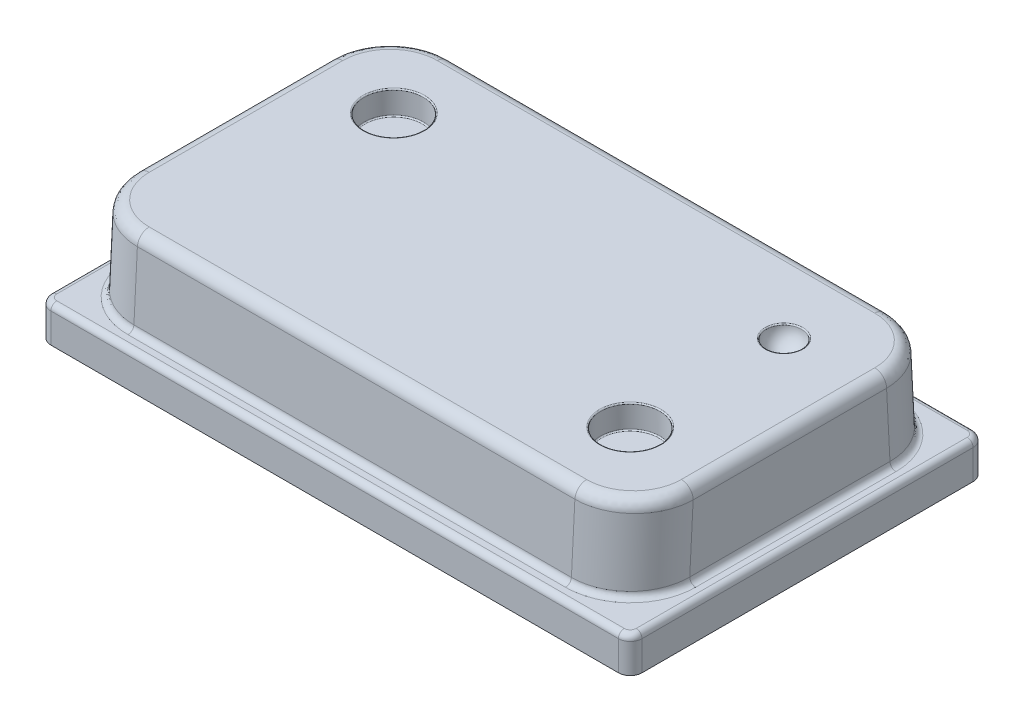
from build123d import *

# Parameters (mm, degrees)
IZIM1_W                     = 5
IZIM1_H                     = 3
Y_KSEKLIK_EKSTR_ZYON1_DEPTH = 0.3
Y_KSEKLIK_EKSTR_ZYON3_DEPTH = 2.35
IZIM5_R                     = 0.25
KES_EKSTR_ZYON1_DEPTH       = 0.2
IZIM11_R                    = 0.15
KES_EKSTR_ZYON3_DEPTH       = 0.15
RADYUS13_R                  = 0.15
RADYUS6_R                   = 0.1
RADYUS8_R                   = 0.5
RADYUS9_R                   = 0.1
RADYUS10_R                  = 0.05
RADYUS11_R                  = 0.05
RADYUS12_R                  = 0.01
RADYUS14_R                  = 0.01


with BuildPart() as part:
    # Çizim1 → Yükseklik-Ekstrüzyon1 (new body)
    with BuildSketch(Plane(origin=(0, 0, 0), x_dir=(1, 0, 0), z_dir=(0, 1, 0))):
        Rectangle(IZIM1_W, IZIM1_H)
    extrude(amount=Y_KSEKLIK_EKSTR_ZYON1_DEPTH)

    # Çizim3 → Yükseklik-Ekstrüzyon3 (add, symmetric)
    with BuildSketch(Plane(origin=(0, 0, 0), x_dir=(0, 0, -1), z_dir=(1, 0, 0))):
        Polygon((-1.35, 0.3), (1.35, 0.3), (1.313314555, 1), (-1.313314555, 1), align=None)
    extrude(amount=Y_KSEKLIK_EKSTR_ZYON3_DEPTH, both=True)

    # Çizim5 → Kes-Ekstrüzyon1 (cut)
    with BuildSketch(Plane(origin=(0, 1, 0), x_dir=(1, 0, 0), z_dir=(0, 1, 0))):
        with Locations(Location((1.65, -0.65, 0), (0, 0, 270))):
            Circle(IZIM5_R)
        with Locations(Location((-1.65, 0.65, 0), (0, 0, 270))):
            Circle(IZIM5_R)
    extrude(amount=-KES_EKSTR_ZYON1_DEPTH, mode=Mode.SUBTRACT)

    # Çizim11 → Kes-Ekstrüzyon3 (cut)
    with BuildSketch(Plane(origin=(0, 1, 0), x_dir=(1, 0, 0), z_dir=(0, 1, 0))):
        with Locations(Location((1.65, 0.65, 0), (0, 0, 270))):
            Circle(IZIM11_R)
    extrude(amount=-KES_EKSTR_ZYON3_DEPTH, mode=Mode.SUBTRACT)

    # Radyus13
    radyus13_edges = [part.edges().sort_by_distance(p)[0] for p in [
        (1.65, 0.85, -0.8),
    ]]
    fillet(radyus13_edges, radius=RADYUS13_R - 0.0001)  # a hair under: the kernel refuses the full size

    # Radyus6
    radyus6_edges = [part.edges().sort_by_distance(p)[0] for p in [
        (2.5, 0.15, 1.5),
        (-2.5, 0.15, 1.5),
        (-2.5, 0.15, -1.5),
        (2.5, 0.15, -1.5),
    ]]
    fillet(radyus6_edges, radius=RADYUS6_R)

    # Radyus8
    radyus8_edges = [part.edges().sort_by_distance(p)[0] for p in [
        (-2.35, 0.65, -1.331657277),
        (-2.35, 0.65, 1.331657277),
        (2.35, 0.65, -1.331657277),
        (2.35, 0.65, 1.331657277),
    ]]
    fillet(radyus8_edges, radius=RADYUS8_R)

    # Radyus9
    radyus9_edges = [part.edges().sort_by_distance(p)[0] for p in [
        (0, 1, 1.313314555),
        (-2.35, 1, 0),
        (2.35, 1, 0),
        (0, 1, -1.313314555),
        (2.203674586, 1, -1.166545566),
        (2.203674586, 1, 1.166545566),
        (-2.203674586, 1, -1.166545566),
        (-2.203674586, 1, 1.166545566),
    ]]
    fillet(radyus9_edges, radius=RADYUS9_R)

    # Radyus10
    radyus10_edges = [part.edges().sort_by_distance(p)[0] for p in [
        (2.5, 0.3, 0),
        (0, 0.3, 1.5),
        (0, 0.3, -1.5),
        (-2.5, 0.3, 0),
        (-2.470710678, 0.3, -1.470710678),
        (2.470710678, 0.3, -1.470710678),
        (-2.470710678, 0.3, 1.470710678),
        (2.470710678, 0.3, 1.470710678),
    ]]
    fillet(radyus10_edges, radius=RADYUS10_R)

    # Radyus11
    radyus11_edges = [part.edges().sort_by_distance(p)[0] for p in [
        (0, 0.3, 1.35),
        (-2.35, 0.3, 0),
        (0, 0.3, -1.35),
        (2.35, 0.3, 0),
        (-2.203674586, 0.3, 1.203231012),
        (-2.203674586, 0.3, -1.203231012),
        (2.203674586, 0.3, 1.203231012),
        (2.203674586, 0.3, -1.203231012),
    ]]
    fillet(radyus11_edges, radius=RADYUS11_R)

    # Radyus12
    radyus12_edges = [part.edges().sort_by_distance(p)[0] for p in [
        (1.65, 0.8, 0.4),
        (1.65, 1, 0.4),
        (-1.65, 0.8, -0.9),
        (-1.65, 1, -0.9),
    ]]
    fillet(radyus12_edges, radius=RADYUS12_R)

    # Radyus14
    radyus14_edges = [part.edges().sort_by_distance(p)[0] for p in [
        (1.65, 1, -0.8),
    ]]
    fillet(radyus14_edges, radius=RADYUS14_R)


solid = part.part
